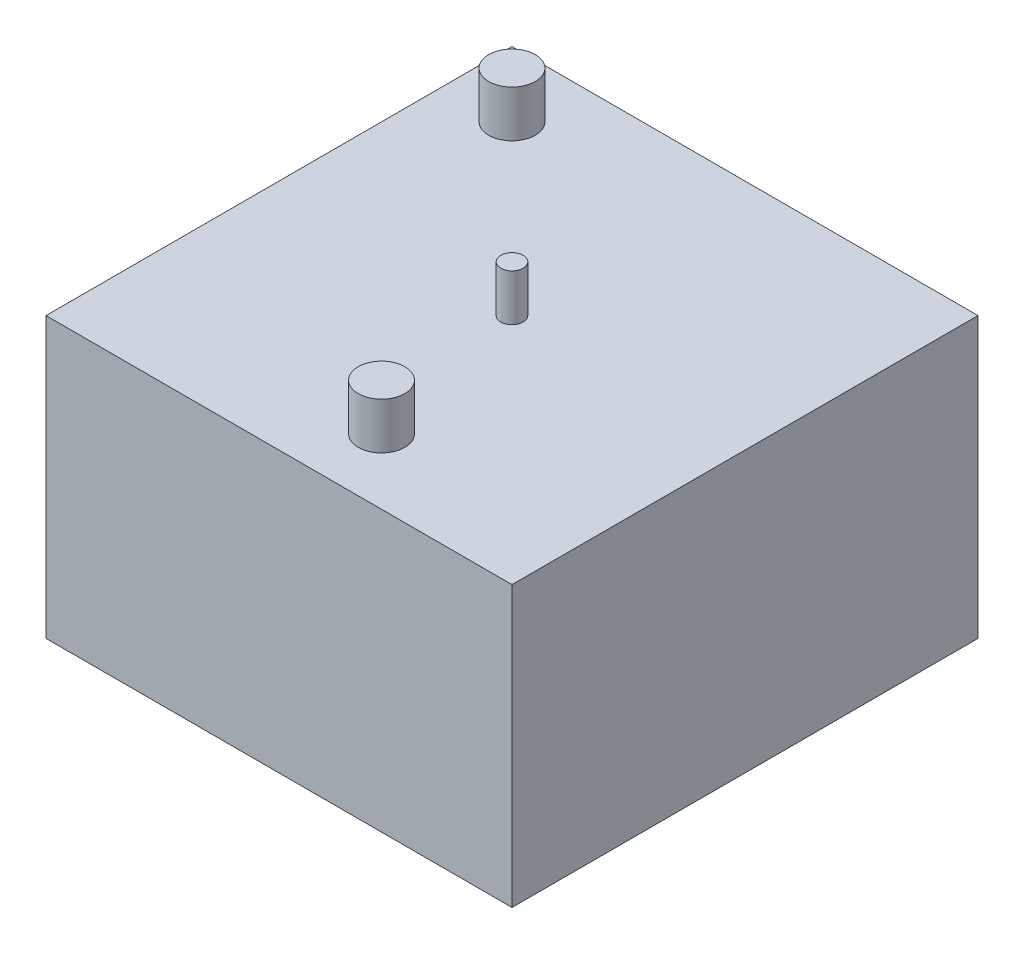
from build123d import *

# Parameters (mm, degrees)
SKETCH1_W           = 63.5
SKETCH1_H           = 63.5
BOSS_EXTRUDE1_DEPTH = 38.1
SKETCH2_R           = 1.524
SKETCH2_R_2         = 3.175
BOSS_EXTRUDE2_DEPTH = 6.35


with BuildPart() as part:
    # Sketch1 → Boss-Extrude1 (new body)
    with BuildSketch(Plane(origin=(0, 0, 0), x_dir=(1, 0, 0), z_dir=(0, 1, 0))):
        with Locations((31.75, 31.75)):
            Rectangle(SKETCH1_W, SKETCH1_H)
    extrude(amount=BOSS_EXTRUDE1_DEPTH)

    # Sketch2 → Boss-Extrude2 (add)
    with BuildSketch(Plane(origin=(0, 38.1, 0), x_dir=(1, 0, 0), z_dir=(0, 1, 0))):
        with Locations((31.75, 31.75)):
            Circle(SKETCH2_R)
        with Locations((8.89, 54.61)):
            Circle(SKETCH2_R_2)
        with Locations((36.83, 8.89)):
            Circle(SKETCH2_R_2)
    extrude(amount=BOSS_EXTRUDE2_DEPTH)


solid = part.part
